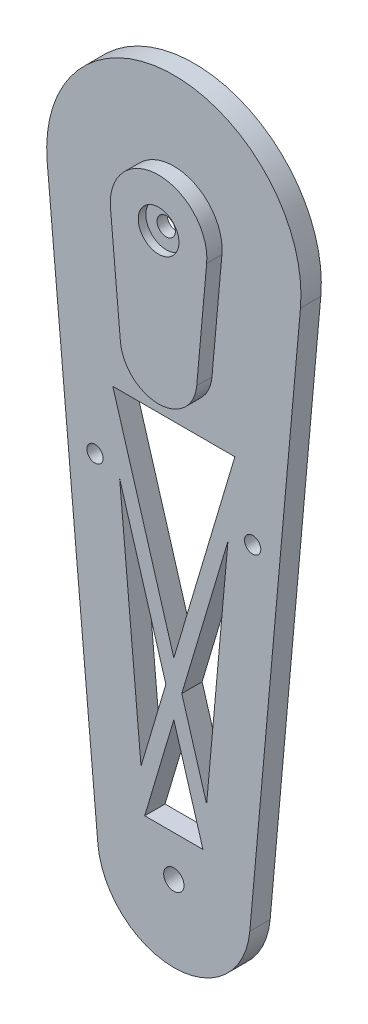
from build123d import *

# Parameters (mm, degrees)
CROQUIS1_R              = 2
SALIENTE_EXTRUIR1_DEPTH = 4
CROQUIS11_R             = 1.6
CORTAR_EXTRUIR1_DEPTH   = 6
CORTAR_EXTRUIR2_REACH   = 141.32
CROQUIS13_R             = 1.8
SALIENTE_EXTRUIR2_DEPTH = 3
SALIENTE_EXTRUIR3_START = -0.5
CROQUIS13_3_R           = 4
CROQUIS13_3_R_2         = 1.8
SALIENTE_EXTRUIR3_DEPTH = 0.5
CORTAR_EXTRUIR3_START   = -1.5
CROQUIS14_R             = 4
CORTAR_EXTRUIR3_DEPTH   = 1.5
CHAFL_N1_SIZE           = 0.5
CROQUIS15_R             = 1.45
CROQUIS15_R_2           = 0.75
SALIENTE_EXTRUIR4_DEPTH = 4
CHAFL_N2_SIZE           = 0.2
CHAFL_N3_SIZE           = 0.4


with BuildPart() as part:
    # Croquis1 → Saliente-Extruir1 (new body)
    with BuildSketch(Plane.XY):
        with BuildLine():
            Line((-24.90015137, 109.767857143), (-14.940090822, -1.339285714))
            ThreePointArc((-14.940090822, -1.339285714), (0, -15), (14.940090822, -1.339285714))
            Line((14.940090822, -1.339285714), (24.90015137, 109.767857143))
            ThreePointArc((24.90015137, 109.767857143), (0, 137), (-24.90015137, 109.767857143))
        make_face()
        Circle(CROQUIS1_R, mode=Mode.SUBTRACT)
        with BuildLine():
            ThreePointArc((0, 84.405), (-2.510229073, 85.444770927), (-3.55, 87.955))
            Line((-3.55, 87.955), (-3.55, 100.917467573))
            ThreePointArc((-3.55, 100.917467573), (-4.131760905, 104.278534717), (-5.80935447, 107.248534369))
            ThreePointArc((-5.80935447, 107.248534369), (-6.670864673, 115.438690086), (0.5, 119.488325914))
            ThreePointArc((0.5, 119.488325914), (5.480762949, 117.127013019), (7.505, 112))
            ThreePointArc((7.505, 112), (7.068388441, 109.477519108), (5.80935447, 107.248534369))
            ThreePointArc((5.80935447, 107.248534369), (4.131760905, 104.278534717), (3.55, 100.917467573))
            Line((3.55, 100.917467573), (3.55, 87.955))
            ThreePointArc((3.55, 87.955), (2.510229073, 85.444770927), (0, 84.405))
        make_face(mode=Mode.SUBTRACT)
    extrude(amount=SALIENTE_EXTRUIR1_DEPTH)

    # Croquis11 → Cortar-Extruir1 (cut)
    with BuildSketch(Plane(origin=(0, 0, 0), x_dir=(-1, 0, 0), z_dir=(0, 0, -1))):
        with Locations((-15.5, 64.768083746)):
            Circle(CROQUIS11_R)
        with Locations((15.5, 64.768083746)):
            Circle(CROQUIS11_R)
    extrude(amount=-CORTAR_EXTRUIR1_DEPTH, mode=Mode.SUBTRACT)

    # Croquis12 → Cortar-Extruir2 (cut, up to next)
    with BuildSketch(Plane.XY.offset(4), mode=Mode.PRIVATE) as cortar_extruir2_sk1:
        Polygon((12, 78), (-12, 78), (0, 37.72237745), align=None)
    cortar_extruir2_tool1 = extrude(cortar_extruir2_sk1.sketch, amount=-CORTAR_EXTRUIR2_REACH, mode=Mode.PRIVATE) & part.part
    # Croquis12 → Cortar-Extruir2 (cut, up to next)
    with BuildSketch(Plane.XY.offset(4), mode=Mode.PRIVATE) as cortar_extruir2_sk2:
        Polygon((5.724937745, 8), (0, 27.215573469), (-5.724937745, 8), align=None)
    cortar_extruir2_tool2 = extrude(cortar_extruir2_sk2.sketch, amount=-CORTAR_EXTRUIR2_REACH, mode=Mode.PRIVATE) & part.part
    # Croquis12 → Cortar-Extruir2 (cut, up to next)
    with BuildSketch(Plane.XY.offset(4), mode=Mode.PRIVATE) as cortar_extruir2_sk3:
        Polygon((-6.448958891, 16.07664978), (-1.565157522, 32.468975459), (-10.652766455, 62.971249003), align=None)
    cortar_extruir2_tool3 = extrude(cortar_extruir2_sk3.sketch, amount=-CORTAR_EXTRUIR2_REACH, mode=Mode.PRIVATE) & part.part
    # Croquis12 → Cortar-Extruir2 (cut, up to next)
    with BuildSketch(Plane.XY.offset(4), mode=Mode.PRIVATE) as cortar_extruir2_sk4:
        Polygon((10.652766455, 62.971249003), (1.565157522, 32.468975459), (6.448958891, 16.07664978), align=None)
    cortar_extruir2_tool4 = extrude(cortar_extruir2_sk4.sketch, amount=-CORTAR_EXTRUIR2_REACH, mode=Mode.PRIVATE) & part.part
    add(cortar_extruir2_tool1.solids().sort_by_distance((0, 64.574126, 4))[0], mode=Mode.SUBTRACT)
    add(cortar_extruir2_tool2.solids().sort_by_distance((0, 14.405191, 4))[0], mode=Mode.SUBTRACT)
    add(cortar_extruir2_tool3.solids().sort_by_distance((-6.222294, 37.172291, 4))[0], mode=Mode.SUBTRACT)
    add(cortar_extruir2_tool4.solids().sort_by_distance((6.222294, 37.172291, 4))[0], mode=Mode.SUBTRACT)

    # Croquis13 → Saliente-Extruir2 (add)
    with BuildSketch(Plane.XY.offset(4)):
        with BuildLine():
            Line((7.50135796, 89.349775463), (9.45582195, 111.152344694))
            ThreePointArc((9.45582195, 111.152344694), (0, 121.493739424), (-9.45582195, 111.152344694))
            Line((-9.45582195, 111.152344694), (-7.50135796, 89.349775463))
            ThreePointArc((-7.50135796, 89.349775463), (0, 82.490787183), (7.50135796, 89.349775463))
        make_face()
        with Locations((0, 112)):
            Circle(CROQUIS13_R, mode=Mode.SUBTRACT)
    extrude(amount=SALIENTE_EXTRUIR2_DEPTH)

    # Croquis13<3> → Saliente-Extruir3 (add)
    with BuildSketch(Plane.XY.offset(4).offset(SALIENTE_EXTRUIR3_START)):
        with Locations((0, 112)):
            Circle(CROQUIS13_3_R)
        with Locations((0, 112)):
            Circle(CROQUIS13_3_R_2, mode=Mode.SUBTRACT)
    extrude(amount=SALIENTE_EXTRUIR3_DEPTH)

    # Croquis14 → Cortar-Extruir3 (cut)
    with BuildSketch(Plane.XY.offset(7).offset(CORTAR_EXTRUIR3_START)):
        with Locations((0, 112)):
            Circle(CROQUIS14_R)
    extrude(amount=CORTAR_EXTRUIR3_DEPTH, mode=Mode.SUBTRACT)

    # Chaflán1
    chafl_n1_edges = [part.edges().sort_by_distance(p)[0] for p in [
        (0, 84.405, 0),
        (-3.55, 94.436233786, 0),
        (3.55, 94.436233786, 0),
        (4.131760905, 104.278534717, 0),
        (-4.131760905, 104.278534717, 0),
        (-2.522480892, 119.068388441, 0),
    ]]
    chamfer(chafl_n1_edges, length=CHAFL_N1_SIZE)

    # Croquis15 → Saliente-Extruir4 (add)
    # profile 1 of 2: a face of its own
    with BuildSketch(Plane(origin=(0, 0, 4), x_dir=(-1, 0, 0), z_dir=(0, 0, -1))):
        with Locations((0, 87.915)):
            Circle(CROQUIS15_R)
        with Locations((0, 87.915)):
            Circle(CROQUIS15_R_2, mode=Mode.SUBTRACT)
    # profile 2 of 2: a face of its own
    with BuildSketch(Plane(origin=(0, 0, 4), x_dir=(-1, 0, 0), z_dir=(0, 0, -1))):
        with Locations((0, 91.915)):
            Circle(CROQUIS15_R)
        with Locations((0, 91.915)):
            Circle(CROQUIS15_R_2, mode=Mode.SUBTRACT)
    extrude(amount=SALIENTE_EXTRUIR4_DEPTH)

    # Chaflán2
    chafl_n2_edges = [part.edges().sort_by_distance(p)[0] for p in [
        (1.45, 87.915, 0),
        (1.45, 91.915, 0),
    ]]
    chamfer(chafl_n2_edges, length=CHAFL_N2_SIZE)

    # Chaflán3
    chafl_n3_edges = [part.edges().sort_by_distance(p)[0] for p in [
        (1.45, 87.915, 4),
        (1.45, 91.915, 4),
    ]]
    chamfer(chafl_n3_edges, length=CHAFL_N3_SIZE)


solid = part.part
